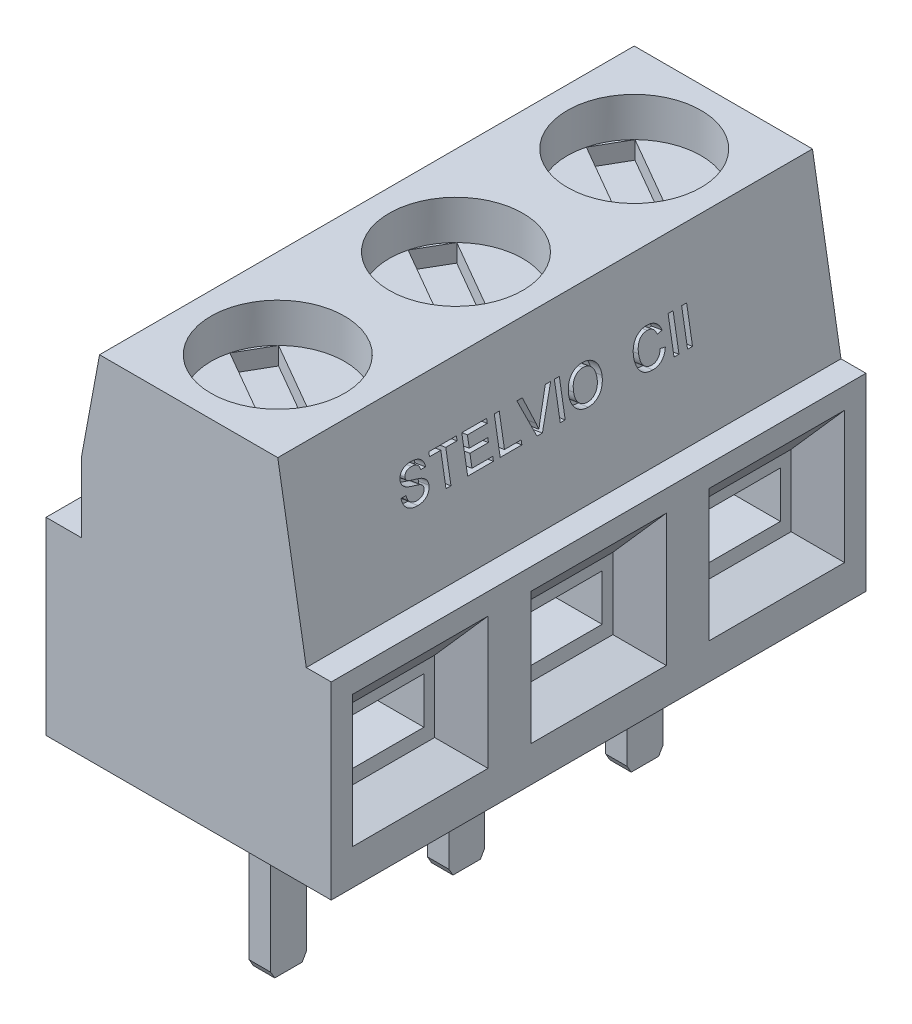
from build123d import *
from OCP.BRepFilletAPI import BRepFilletAPI_MakeChamfer

# Parameters (mm, degrees)
Z_KLAD_PROTA_EN_DEPTH    = 15
SKICA2_R                 = 1.875
ODEBR_N_PROTA_EN_1_DEPTH = 1.1
ODEBR_N_PROTA_EN_2_DEPTH = 0.5
SKICA4_W                 = 2.1
SKICA4_H                 = 3
SKICA4_W_2               = 1.2
SKICA4_H_2               = 1
ODEBR_N_PROTA_EN_3_DEPTH = 0.5
SKICA5_W                 = 2.8
SKICA5_H                 = 2
ODEBR_N_PROTA_EN_4_DEPTH = 1
LINE_RN_POLE1_COUNT      = 3
LINE_RN_POLE1_PITCH      = 5
ZKOSEN_1_SIZE            = 1.2
ZKOSEN_1_SIZE_2          = 1
ZKOSEN_2_SIZE            = 0.5
ZKOSEN_2_SIZE_2          = 1
SKICA6_W                 = 2.1
SKICA6_H                 = 1.3
ODEBR_N_PROTA_EN_5_DEPTH = 2
LINE_RN_POLE2_COUNT      = 3
LINE_RN_POLE2_PITCH      = 5
SKICA7_W                 = 0.6
SKICA7_H                 = 1
P_ID_N_PROTA_EN_1_DEPTH  = 4.8
LINE_RN_POLE3_COUNT      = 3
LINE_RN_POLE3_PITCH      = 5
ZKOSEN_3_SIZE            = 0.2
ZKOSEN_3_SIZE2           = 0.115470054
SKICA9_W                 = 0.139326146
SKICA9_H                 = 0.987949033
ODEBR_N_PROTA_EN_6_DEPTH = 0.3


# Some blends are built 0.0001 mm under size
with BuildPart() as part:
    # Skica1 → Základ-Protažení (new body)
    with BuildSketch(Plane.XY):
        Polygon((-2.5, 10), (2.5, 10), (3.3, 5.3), (4, 5.3), (4, 0), (-4, 0), (-4, 5.3), (-3, 5.3), (-3, 7.3), align=None)
    extrude(amount=Z_KLAD_PROTA_EN_DEPTH)

    # Skica2 → Odebrání-Protažení1 (cut)
    with BuildSketch(Plane(origin=(0, 10, 0), x_dir=(-1, 0, 0), z_dir=(0, 1, 0))):
        with Locations(Location((0, 2.5, 0), (0, 0, 90))):
            Circle(SKICA2_R)
        with Locations(Location((0, 7.5, 0), (0, 0, 90))):
            Circle(SKICA2_R)
        with Locations(Location((0, 12.5, 0), (0, 0, 90))):
            Circle(SKICA2_R)
    extrude(amount=-ODEBR_N_PROTA_EN_1_DEPTH, mode=Mode.SUBTRACT)

    # Skica3 → Odebrání-Protažení2 (cut)
    with BuildSketch(Plane(origin=(0, 8.9, 0), x_dir=(-1, 0, 0), z_dir=(0, 1, 0))):
        Polygon((1.814998003, 2.029460683), (-1.314998003, 3.83656472), (-1.814998003, 2.970539317), (1.314998003, 1.16343528), align=None)
        Polygon((1.814998003, 7.029460683), (-1.314998003, 8.83656472), (-1.814998003, 7.970539317), (1.314998003, 6.16343528), align=None)
        Polygon((1.814998003, 12.029460683), (-1.314998003, 13.83656472), (-1.814998003, 12.970539317), (1.314998003, 11.16343528), align=None)
    extrude(amount=-ODEBR_N_PROTA_EN_2_DEPTH, mode=Mode.SUBTRACT)

    # Skica4 → Odebrání-Protažení3 (cut)
    with BuildSketch(Plane.ZY.offset(4)):
        with Locations((12.5, 3.8)):
            Rectangle(SKICA4_W, SKICA4_H)
        with Locations((12.5, 0.5)):
            Rectangle(SKICA4_W_2, SKICA4_H_2)
        with Locations((7.5, 3.8)):
            Rectangle(SKICA4_W, SKICA4_H)
        with Locations((7.5, 0.5)):
            Rectangle(SKICA4_W_2, SKICA4_H_2)
        with Locations((2.5, 3.8)):
            Rectangle(SKICA4_W, SKICA4_H)
        with Locations((2.5, 0.5)):
            Rectangle(SKICA4_W_2, SKICA4_H_2)
    extrude(amount=-ODEBR_N_PROTA_EN_3_DEPTH, mode=Mode.SUBTRACT)

    # Skica5 → Odebrání-Protažení4 (cut)
    with BuildSketch(Plane(origin=(4, 0, 0), x_dir=(0, 0, -1), z_dir=(1, 0, 0))):
        with Locations((-12.5, 2.5)):
            Rectangle(SKICA5_W, SKICA5_H)
    odebr_n_prota_en_4 = extrude(amount=-ODEBR_N_PROTA_EN_4_DEPTH, mode=Mode.SUBTRACT)

    # Lineární Pole1: Odebrání-Protažení4 ×3
    with Locations(*[(0, 0, -i * LINE_RN_POLE1_PITCH) for i in range(1, LINE_RN_POLE1_COUNT)]):
        add(odebr_n_prota_en_4, mode=Mode.SUBTRACT)

    # Zkosení1
    # the kernel refuses this chamfer: 1.2, 1 mm, written as the material it adds along each edge
    # the kernel refuses this chamfer: 1.2, 1 mm, written as the material it takes off along each edge
    with BuildSketch(Plane(origin=(4, 3.5, 13.9), x_dir=(0.024836286378920516, 0.9996915318631564, 0), z_dir=(0, 0, -1)), Plane(origin=(4, 3.5, 8.9), x_dir=(0.024836286378920516, 0.9996915318631564, 0), z_dir=(0, 0, -1)), Plane(origin=(4, 3.5, 3.9), x_dir=(0.024836286378920516, 0.9996915318631564, 0), z_dir=(0, 0, -1))) as zkosen_1_2_piece_1:
        Polygon((ZKOSEN_1_SIZE * 0.999691531863, -ZKOSEN_1_SIZE * 0.0248362863789), (-ZKOSEN_1_SIZE_2 * 0.0248362863789, -ZKOSEN_1_SIZE_2 * 0.999691531863), (0, 0), align=None)
    extrude(amount=2.8, mode=Mode.SUBTRACT)
    with BuildSketch(Plane(origin=(4, 3.5, 16.993140689), x_dir=(0.024836286378920505, 0.9996915318631564, 0), z_dir=(0, 0, -1))) as zkosen_1_2_piece_2_section:
        Polygon((ZKOSEN_1_SIZE * 0.999691531863, -ZKOSEN_1_SIZE * 0.0248362863789), (-ZKOSEN_1_SIZE_2 * 0.0248362863789, -ZKOSEN_1_SIZE_2 * 0.999691531863), (0, 0), align=None)
    zkosen_1_2_piece_2 = extrude(amount=8.986281378, mode=Mode.PRIVATE)
    zkosen_1_2_piece_2 = split(zkosen_1_2_piece_2, bisect_by=Plane(origin=(3.666666667, 3.9, 8.9), z_dir=(0, 0, -1)), keep=Keep.TOP, mode=Mode.PRIVATE)
    add(zkosen_1_2_piece_2, mode=Mode.SUBTRACT)
    with BuildSketch(Plane(origin=(4, 3.5, 11.993140689), x_dir=(0.024836286378920505, 0.9996915318631564, 0), z_dir=(0, 0, -1))) as zkosen_1_2_piece_3_section:
        Polygon((ZKOSEN_1_SIZE * 0.999691531863, -ZKOSEN_1_SIZE * 0.0248362863789), (-ZKOSEN_1_SIZE_2 * 0.0248362863789, -ZKOSEN_1_SIZE_2 * 0.999691531863), (0, 0), align=None)
    zkosen_1_2_piece_3 = extrude(amount=8.986281378, mode=Mode.PRIVATE)
    zkosen_1_2_piece_3 = split(zkosen_1_2_piece_3, bisect_by=Plane(origin=(3.666666667, 3.9, 11.1), z_dir=(0, 0, 1)), keep=Keep.TOP, mode=Mode.PRIVATE)
    add(zkosen_1_2_piece_3, mode=Mode.SUBTRACT)
    with BuildSketch(Plane(origin=(4, 3.5, 11.993140689), x_dir=(0.024836286378920505, 0.9996915318631564, 0), z_dir=(0, 0, -1))) as zkosen_1_2_piece_4_section:
        Polygon((ZKOSEN_1_SIZE * 0.999691531863, -ZKOSEN_1_SIZE * 0.0248362863789), (-ZKOSEN_1_SIZE_2 * 0.0248362863789, -ZKOSEN_1_SIZE_2 * 0.999691531863), (0, 0), align=None)
    zkosen_1_2_piece_4 = extrude(amount=8.986281378, mode=Mode.PRIVATE)
    zkosen_1_2_piece_4 = split(zkosen_1_2_piece_4, bisect_by=Plane(origin=(3.666666667, 3.9, 3.9), z_dir=(0, 0, -1)), keep=Keep.TOP, mode=Mode.PRIVATE)
    add(zkosen_1_2_piece_4, mode=Mode.SUBTRACT)
    with BuildSketch(Plane(origin=(4, 3.5, 6.993140689), x_dir=(0.024836286378920505, 0.9996915318631564, 0), z_dir=(0, 0, -1))) as zkosen_1_2_piece_5_section:
        Polygon((ZKOSEN_1_SIZE * 0.999691531863, -ZKOSEN_1_SIZE * 0.0248362863789), (-ZKOSEN_1_SIZE_2 * 0.0248362863789, -ZKOSEN_1_SIZE_2 * 0.999691531863), (0, 0), align=None)
    zkosen_1_2_piece_5 = extrude(amount=8.986281378, mode=Mode.PRIVATE)
    zkosen_1_2_piece_5 = split(zkosen_1_2_piece_5, bisect_by=Plane(origin=(3.666666667, 3.9, 6.1), z_dir=(0, 0, 1)), keep=Keep.TOP, mode=Mode.PRIVATE)
    add(zkosen_1_2_piece_5, mode=Mode.SUBTRACT)

    # Zkosení2
    zkosen_2_edges_1 = [part.edges().sort_by_distance(p)[0] for p in [
        (4, 3.1, 13.9),
    ]]
    zkosen_2_side_1 = [part.faces().sort_by_distance(p)[0] for p in [
        (4, 3.1, 13.91),
    ]]
    zkosen_2_edges_2 = [part.edges().sort_by_distance(p)[0] for p in [
        (4, 1.5, 12.5),
    ]]
    zkosen_2_side_2 = [part.faces().sort_by_distance(p)[0] for p in [
        (4, 1.49, 12.5),
    ]]
    zkosen_2_edges_3 = [part.edges().sort_by_distance(p)[0] for p in [
        (4, 3.1, 11.1),
    ]]
    zkosen_2_side_3 = [part.faces().sort_by_distance(p)[0] for p in [
        (4, 3.1, 11.09),
    ]]
    zkosen_2_edges_4 = [part.edges().sort_by_distance(p)[0] for p in [
        (4, 3.1, 8.9),
    ]]
    zkosen_2_side_4 = [part.faces().sort_by_distance(p)[0] for p in [
        (4, 3.1, 8.91),
    ]]
    zkosen_2_edges_5 = [part.edges().sort_by_distance(p)[0] for p in [
        (4, 1.5, 7.5),
    ]]
    zkosen_2_side_5 = [part.faces().sort_by_distance(p)[0] for p in [
        (4, 1.49, 7.5),
    ]]
    zkosen_2_edges_6 = [part.edges().sort_by_distance(p)[0] for p in [
        (4, 3.1, 6.1),
    ]]
    zkosen_2_side_6 = [part.faces().sort_by_distance(p)[0] for p in [
        (4, 3.1, 6.09),
    ]]
    zkosen_2_edges_7 = [part.edges().sort_by_distance(p)[0] for p in [
        (4, 3.1, 3.9),
    ]]
    zkosen_2_side_7 = [part.faces().sort_by_distance(p)[0] for p in [
        (4, 3.1, 3.91),
    ]]
    zkosen_2_edges_8 = [part.edges().sort_by_distance(p)[0] for p in [
        (4, 3.1, 1.1),
    ]]
    zkosen_2_side_8 = [part.faces().sort_by_distance(p)[0] for p in [
        (4, 3.1, 1.09),
    ]]
    zkosen_2_edges_9 = [part.edges().sort_by_distance(p)[0] for p in [
        (4, 1.5, 2.5),
    ]]
    zkosen_2_side_9 = [part.faces().sort_by_distance(p)[0] for p in [
        (4, 1.49, 2.5),
    ]]
    zkosen_2 = BRepFilletAPI_MakeChamfer(part.part.solid().wrapped)
    for e in zkosen_2_edges_1:
        zkosen_2.Add(ZKOSEN_2_SIZE - 0.0001, ZKOSEN_2_SIZE_2 - 0.0001, e.wrapped, zkosen_2_side_1[0].wrapped)
    for e in zkosen_2_edges_2:
        zkosen_2.Add(ZKOSEN_2_SIZE - 0.0001, ZKOSEN_2_SIZE_2 - 0.0001, e.wrapped, zkosen_2_side_2[0].wrapped)
    for e in zkosen_2_edges_3:
        zkosen_2.Add(ZKOSEN_2_SIZE - 0.0001, ZKOSEN_2_SIZE_2 - 0.0001, e.wrapped, zkosen_2_side_3[0].wrapped)
    for e in zkosen_2_edges_4:
        zkosen_2.Add(ZKOSEN_2_SIZE - 0.0001, ZKOSEN_2_SIZE_2 - 0.0001, e.wrapped, zkosen_2_side_4[0].wrapped)
    for e in zkosen_2_edges_5:
        zkosen_2.Add(ZKOSEN_2_SIZE - 0.0001, ZKOSEN_2_SIZE_2 - 0.0001, e.wrapped, zkosen_2_side_5[0].wrapped)
    for e in zkosen_2_edges_6:
        zkosen_2.Add(ZKOSEN_2_SIZE - 0.0001, ZKOSEN_2_SIZE_2 - 0.0001, e.wrapped, zkosen_2_side_6[0].wrapped)
    for e in zkosen_2_edges_7:
        zkosen_2.Add(ZKOSEN_2_SIZE - 0.0001, ZKOSEN_2_SIZE_2 - 0.0001, e.wrapped, zkosen_2_side_7[0].wrapped)
    for e in zkosen_2_edges_8:
        zkosen_2.Add(ZKOSEN_2_SIZE - 0.0001, ZKOSEN_2_SIZE_2 - 0.0001, e.wrapped, zkosen_2_side_8[0].wrapped)
    for e in zkosen_2_edges_9:
        zkosen_2.Add(ZKOSEN_2_SIZE - 0.0001, ZKOSEN_2_SIZE_2 - 0.0001, e.wrapped, zkosen_2_side_9[0].wrapped)
    add(Compound.cast(zkosen_2.Shape()), mode=Mode.REPLACE)  # a hair under: the kernel refuses the full size

    # Skica6 → Odebrání-Protažení5 (cut)
    with BuildSketch(Plane(origin=(3, 0, 0), x_dir=(0, 0, -1), z_dir=(1, 0, 0))):
        with Locations((-12.45, 2.55)):
            Rectangle(SKICA6_W, SKICA6_H)
    odebr_n_prota_en_5 = extrude(amount=-ODEBR_N_PROTA_EN_5_DEPTH, mode=Mode.SUBTRACT)

    # Lineární Pole2: Odebrání-Protažení5 ×3
    with Locations(*[(0, 0, -i * LINE_RN_POLE2_PITCH) for i in range(1, LINE_RN_POLE2_COUNT)]):
        add(odebr_n_prota_en_5, mode=Mode.SUBTRACT)

    # Skica7 → Přidání-Protažení1 (add)
    with BuildSketch(Plane.XZ):
        with Locations((0, 2.5)):
            Rectangle(SKICA7_W, SKICA7_H)
    p_id_n_prota_en_1 = extrude(amount=P_ID_N_PROTA_EN_1_DEPTH)

    # Lineární Pole3: Přidání-Protažení1 ×3
    with Locations(*[(0, 0, i * LINE_RN_POLE3_PITCH) for i in range(1, LINE_RN_POLE3_COUNT)]):
        add(p_id_n_prota_en_1)

    # Zkosení3: one chamfer whose edges measure the first distance from different faces: ONE call of the kernel's chamfer builder (chamfer() names one face for all edges)
    zkosen_3_edges_1 = [part.edges().sort_by_distance(p)[0] for p in [
        (0, -4.8, 2),
    ]]
    zkosen_3_side_1 = [part.faces().sort_by_distance(p)[0] for p in [
        (0, -2.4, 2),
    ]]
    zkosen_3_edges_2 = [part.edges().sort_by_distance(p)[0] for p in [
        (0, -4.8, 3),
    ]]
    zkosen_3_side_2 = [part.faces().sort_by_distance(p)[0] for p in [
        (0, -2.4, 3),
    ]]
    zkosen_3_edges_3 = [part.edges().sort_by_distance(p)[0] for p in [
        (0, -4.8, 7),
    ]]
    zkosen_3_side_3 = [part.faces().sort_by_distance(p)[0] for p in [
        (0, -2.4, 7),
    ]]
    zkosen_3_edges_4 = [part.edges().sort_by_distance(p)[0] for p in [
        (0, -4.8, 8),
    ]]
    zkosen_3_side_4 = [part.faces().sort_by_distance(p)[0] for p in [
        (0, -2.4, 8),
    ]]
    zkosen_3_edges_5 = [part.edges().sort_by_distance(p)[0] for p in [
        (0, -4.8, 12),
    ]]
    zkosen_3_side_5 = [part.faces().sort_by_distance(p)[0] for p in [
        (0, -2.4, 12),
    ]]
    zkosen_3_edges_6 = [part.edges().sort_by_distance(p)[0] for p in [
        (0, -4.8, 13),
    ]]
    zkosen_3_side_6 = [part.faces().sort_by_distance(p)[0] for p in [
        (0, -2.4, 13),
    ]]
    zkosen_3 = BRepFilletAPI_MakeChamfer(part.part.solid().wrapped)
    for e in zkosen_3_edges_1:
        zkosen_3.Add(ZKOSEN_3_SIZE, ZKOSEN_3_SIZE2, e.wrapped, zkosen_3_side_1[0].wrapped)  # the first distance lies on this face
    for e in zkosen_3_edges_2:
        zkosen_3.Add(ZKOSEN_3_SIZE, ZKOSEN_3_SIZE2, e.wrapped, zkosen_3_side_2[0].wrapped)  # the first distance lies on this face
    for e in zkosen_3_edges_3:
        zkosen_3.Add(ZKOSEN_3_SIZE, ZKOSEN_3_SIZE2, e.wrapped, zkosen_3_side_3[0].wrapped)  # the first distance lies on this face
    for e in zkosen_3_edges_4:
        zkosen_3.Add(ZKOSEN_3_SIZE, ZKOSEN_3_SIZE2, e.wrapped, zkosen_3_side_4[0].wrapped)  # the first distance lies on this face
    for e in zkosen_3_edges_5:
        zkosen_3.Add(ZKOSEN_3_SIZE, ZKOSEN_3_SIZE2, e.wrapped, zkosen_3_side_5[0].wrapped)  # the first distance lies on this face
    for e in zkosen_3_edges_6:
        zkosen_3.Add(ZKOSEN_3_SIZE, ZKOSEN_3_SIZE2, e.wrapped, zkosen_3_side_6[0].wrapped)  # the first distance lies on this face
    add(Compound.cast(zkosen_3.Shape()), mode=Mode.REPLACE)

    # Skica9 → Odebrání-Protažení6 (cut)
    # profile 1 of 10: a face of its own
    with BuildSketch(Plane(origin=(4.083809943, 0.695116586, 0), x_dir=(0, 0, -1), z_dir=(0.9858211697841271, 0.16779934804836208, 0))):
        with BuildLine():
            Line((-11.936669934, 7.080695685), (-11.797343788, 7.080695685))
            add(Edge.make_bspline(
                [(-11.797343788, 7.080695685), (-11.795811281, 7.068186113), (-11.792867253, 7.044154552), (-11.784635457, 7.010093431), (-11.774040604, 6.979468988), (-11.760839709, 6.951874782), (-11.743474434, 6.927641666), (-11.722552266, 6.905783766), (-11.697143431, 6.886856147), (-11.668462648, 6.870011807), (-11.636520261, 6.856786336), (-11.602418913, 6.846982076), (-11.56632124, 6.841172975), (-11.541603774, 6.840423915), (-11.528982632, 6.840041434)],
                knots=[0, 0, 0, 0, 1.125557648, 2.162256852, 3.1243583, 4.018160113, 4.88511607, 5.777380551, 6.711250965, 7.707237736, 8.743031335, 9.791730543, 10.872421559, 12, 12, 12, 12], degree=3))
            add(Edge.make_bspline(
                [(-11.528982632, 6.840041434), (-11.517814009, 6.840248153), (-11.496037356, 6.840651216), (-11.464534994, 6.845492997), (-11.43489118, 6.852360933), (-11.407657616, 6.862749762), (-11.382934763, 6.875365057), (-11.361465736, 6.890623553), (-11.343136622, 6.907830945), (-11.328783598, 6.927440466), (-11.317508148, 6.947987965), (-11.30923644, 6.969108675), (-11.304309154, 6.990685365), (-11.303681289, 7.005203275), (-11.303369272, 7.012417958)],
                knots=[0, 0, 0, 0, 1.267006637, 2.470417599, 3.611360613, 4.716023143, 5.771382139, 6.754486395, 7.697536124, 8.612899418, 9.501261124, 10.352596716, 11.181322154, 12, 12, 12, 12], degree=3))
            add(Edge.make_bspline(
                [(-11.303369272, 7.012417958), (-11.303702824, 7.019559559), (-11.304354752, 7.03351781), (-11.308603186, 7.053839279), (-11.316677936, 7.072439325), (-11.327155852, 7.090077117), (-11.341732421, 7.106203056), (-11.360148272, 7.121061671), (-11.382809151, 7.134532635), (-11.399722088, 7.14191012), (-11.408655507, 7.14580691)],
                knots=[0, 0, 0, 0, 0.942140154, 1.841411588, 2.718743672, 3.605002079, 4.535543111, 5.568170452, 6.715506882, 8, 8, 8, 8], degree=3))
            add(Edge.make_bspline(
                [(-11.408655507, 7.14580691), (-11.412136099, 7.14723523), (-11.419999388, 7.150462064), (-11.433476698, 7.154733838), (-11.449469232, 7.160257677), (-11.468361199, 7.165946332), (-11.490051462, 7.171964133), (-11.514503909, 7.178775372), (-11.541704875, 7.186018751), (-11.570882896, 7.19372854), (-11.600343805, 7.201568213), (-11.628490262, 7.209415227), (-11.65438634, 7.217380952), (-11.678244164, 7.225050845), (-11.699940735, 7.232752382), (-11.719537633, 7.240274711), (-11.737059292, 7.247465213), (-11.747760854, 7.25275228), (-11.752814835, 7.25524918)],
                knots=[0, 0, 0, 0, 0.499201778, 1.127787504, 1.87543728, 2.745208432, 3.745951656, 4.863402235, 6.114490242, 7.482339553, 8.869366102, 10.161191451, 11.360587006, 12.46547846, 13.487450326, 14.41601931, 15.251940103, 16, 16, 16, 16], degree=3))
            add(Edge.make_bspline(
                [(-11.752814835, 7.25524918), (-11.764442637, 7.261530854), (-11.786887321, 7.273656119), (-11.81709538, 7.295336126), (-11.842548737, 7.319394107), (-11.863140007, 7.345795177), (-11.879276581, 7.374092829), (-11.890163856, 7.404335171), (-11.897620741, 7.435973247), (-11.898317606, 7.457729384), (-11.898671894, 7.468790247)],
                knots=[0, 0, 0, 0, 1.158441928, 2.236094408, 3.251151369, 4.220012324, 5.163146324, 6.095083285, 7.031536583, 8, 8, 8, 8], degree=3))
            add(Edge.make_bspline(
                [(-11.898671894, 7.468790247), (-11.898201684, 7.481038285), (-11.897266439, 7.505399543), (-11.888970305, 7.541148171), (-11.875737813, 7.575547859), (-11.860675218, 7.602858276), (-11.845985859, 7.623510291), (-11.83380827, 7.638383495), (-11.820148721, 7.652131773), (-11.80542788, 7.66494704), (-11.789382596, 7.676637823), (-11.772410956, 7.687684598), (-11.75389868, 7.697179566), (-11.727886179, 7.709264517), (-11.69308772, 7.721332471), (-11.649280813, 7.731848162), (-11.603175481, 7.738040634), (-11.571749004, 7.738893056), (-11.555700004, 7.739328374)],
                knots=[0, 0, 0, 0, 1.199927478, 2.386647047, 3.578628709, 4.806592355, 5.433127754, 6.062729195, 6.689531802, 7.331674828, 7.974827539, 8.635320743, 9.315455226, 10.01318112, 11.447700238, 12.918145351, 14.426146008, 16, 16, 16, 16], degree=3))
            add(Edge.make_bspline(
                [(-11.555700004, 7.739328374), (-11.538133307, 7.73892586), (-11.503927564, 7.738142088), (-11.454225652, 7.731621244), (-11.407867374, 7.72042324), (-11.371511622, 7.707888198), (-11.34463424, 7.695198169), (-11.325539799, 7.685296268), (-11.307816382, 7.673847867), (-11.291304442, 7.661458906), (-11.275850607, 7.648135042), (-11.261852073, 7.633559347), (-11.248700987, 7.618229115), (-11.233246627, 7.596219705), (-11.216583551, 7.567090375), (-11.202176054, 7.529352172), (-11.192277935, 7.489522597), (-11.190352523, 7.461987392), (-11.189375152, 7.448010069)],
                knots=[0, 0, 0, 0, 1.607600973, 3.130308851, 4.577334065, 5.967726088, 6.640410691, 7.296826776, 7.935019992, 8.569057421, 9.185393759, 9.8003086, 10.417295362, 11.032210203, 12.259799365, 13.477607022, 14.719591916, 16, 16, 16, 16], degree=3))
            Line((-11.189375152, 7.448010069), (-11.328701298, 7.448010069))
            add(Edge.make_bspline(
                [(-11.328701298, 7.448010069), (-11.329586556, 7.455084401), (-11.331318743, 7.468926771), (-11.335616069, 7.488965684), (-11.341640056, 7.507576924), (-11.348695991, 7.524934055), (-11.357249261, 7.540856543), (-11.367219899, 7.555497278), (-11.378729326, 7.568683768), (-11.391481392, 7.58076445), (-11.405864141, 7.591283351), (-11.421803669, 7.600414081), (-11.439326883, 7.608127457), (-11.458418345, 7.614444963), (-11.479081835, 7.619343311), (-11.501364351, 7.622946629), (-11.525257282, 7.624792049), (-11.541711972, 7.625150336), (-11.550158623, 7.625334255)],
                knots=[0, 0, 0, 0, 1.074487479, 2.102453544, 3.083708351, 4.020042547, 4.923259678, 5.803182661, 6.684453325, 7.556870173, 8.445961597, 9.363679789, 10.320905216, 11.327237703, 12.390948353, 13.519046902, 14.726457512, 16, 16, 16, 16], degree=3))
            add(Edge.make_bspline(
                [(-11.550158623, 7.625334255), (-11.558938524, 7.625268076), (-11.575934251, 7.62513997), (-11.600503503, 7.622804762), (-11.623276023, 7.619600774), (-11.644212698, 7.614874619), (-11.663244941, 7.608688067), (-11.68065522, 7.601544018), (-11.695956287, 7.592490643), (-11.709504839, 7.58240636), (-11.72119218, 7.571248658), (-11.731264938, 7.559491138), (-11.740173513, 7.547479244), (-11.747095673, 7.534556398), (-11.752731352, 7.521212008), (-11.756366984, 7.507195243), (-11.758941096, 7.492765377), (-11.759209, 7.48291959), (-11.759345748, 7.477893944)],
                knots=[0, 0, 0, 0, 1.464176581, 2.834285765, 4.113735764, 5.29917439, 6.409476712, 7.449999357, 8.431575861, 9.367089851, 10.262376129, 11.120706676, 11.948504824, 12.751342953, 13.560717798, 14.359016663, 15.162382702, 16, 16, 16, 16], degree=3))
            add(Edge.make_bspline(
                [(-11.759345748, 7.477893944), (-11.758985697, 7.469394065), (-11.75828687, 7.452896583), (-11.751150826, 7.429458635), (-11.74017554, 7.408093426), (-11.729363135, 7.396468725), (-11.723920493, 7.390617197)],
                knots=[0, 0, 0, 0, 1.050964922, 2.039826012, 3.013306874, 4, 4, 4, 4], degree=3))
            add(Edge.make_bspline(
                [(-11.723920493, 7.390617197), (-11.720489509, 7.387692883), (-11.7129021, 7.381225944), (-11.698784557, 7.372667708), (-11.681280897, 7.3640207), (-11.660274164, 7.355424906), (-11.6358005, 7.346775972), (-11.607899383, 7.337870832), (-11.576464539, 7.329026362), (-11.542453946, 7.320503252), (-11.508095316, 7.311945879), (-11.475443067, 7.30342112), (-11.445462774, 7.295341994), (-11.418202006, 7.287462131), (-11.393632545, 7.279803811), (-11.371839779, 7.272206582), (-11.352647397, 7.265219059), (-11.340889796, 7.260302766), (-11.335430118, 7.258019871)],
                knots=[0, 0, 0, 0, 0.523891492, 1.158553688, 1.913783773, 2.794766643, 3.797521443, 4.933638669, 6.202080764, 7.596537849, 9.013317056, 10.322179469, 11.523240428, 12.626146501, 13.623953177, 14.517289671, 15.311498917, 16, 16, 16, 16], degree=3))
            add(Edge.make_bspline(
                [(-11.335430118, 7.258019871), (-11.328326799, 7.254744785), (-11.314384176, 7.24831634), (-11.294632582, 7.237340737), (-11.276202203, 7.225943165), (-11.259241942, 7.213816762), (-11.243806641, 7.20093602), (-11.229723716, 7.187448524), (-11.216908109, 7.173430077), (-11.205876931, 7.158432006), (-11.195972064, 7.143060601), (-11.187304646, 7.127101028), (-11.180325807, 7.110459429), (-11.17420493, 7.093336406), (-11.169802264, 7.075541499), (-11.166349686, 7.057254449), (-11.164335855, 7.038389303), (-11.164141546, 7.025616403), (-11.164043126, 7.019146777)],
                knots=[0, 0, 0, 0, 1.198900896, 2.353241543, 3.461831299, 4.520043694, 5.547003373, 6.541368882, 7.508191797, 8.454912692, 9.392021408, 10.310662301, 11.235020644, 12.156274873, 13.095836685, 14.042125239, 15.00831306, 16, 16, 16, 16], degree=3))
            add(Edge.make_bspline(
                [(-11.164043126, 7.019146777), (-11.164558718, 7.006235162), (-11.165582339, 6.980601314), (-11.174396087, 6.942815837), (-11.18824202, 6.906201921), (-11.204479805, 6.877146762), (-11.21982942, 6.854952842), (-11.232723821, 6.839000868), (-11.24702297, 6.824250836), (-11.262374837, 6.810240657), (-11.278898614, 6.797256184), (-11.296733608, 6.785292997), (-11.315691578, 6.774226558), (-11.342763083, 6.760741454), (-11.378718538, 6.746634755), (-11.42451857, 6.734887174), (-11.472786256, 6.727266227), (-11.505929829, 6.726459234), (-11.522847532, 6.726047314)],
                knots=[0, 0, 0, 0, 1.197055466, 2.376552968, 3.581957237, 4.820753935, 5.454298064, 6.085440993, 6.72202542, 7.359198513, 8.013298489, 8.67051481, 9.351020706, 10.049282741, 11.476266879, 12.925760103, 14.430794493, 16, 16, 16, 16], degree=3))
            add(Edge.make_bspline(
                [(-11.522847532, 6.726047314), (-11.533604159, 6.726136083), (-11.554674854, 6.726309968), (-11.585635887, 6.72841577), (-11.61530641, 6.731461916), (-11.643657307, 6.735999185), (-11.670599672, 6.741951835), (-11.696230216, 6.749099817), (-11.720609689, 6.757332192), (-11.74365291, 6.767013323), (-11.765299726, 6.778261739), (-11.785939369, 6.790395934), (-11.80523447, 6.804150613), (-11.823225647, 6.819309641), (-11.84036876, 6.835435089), (-11.855953276, 6.853185506), (-11.870509029, 6.872041805), (-11.883703426, 6.892176568), (-11.89549061, 6.913326365), (-11.906090647, 6.935136007), (-11.915021327, 6.957763706), (-11.922218605, 6.981095103), (-11.928315064, 7.004974064), (-11.932542817, 7.029599817), (-11.935651204, 7.054895045), (-11.936328351, 7.072044673), (-11.936669934, 7.080695685)],
                knots=[0, 0, 0, 0, 1.259822038, 2.467811403, 3.633536148, 4.752793854, 5.829021491, 6.863980041, 7.868367876, 8.841470325, 9.788447787, 10.724101269, 11.643985084, 12.560193707, 13.478453146, 14.398077254, 15.323914234, 16.266973849, 17.21495974, 18.158525798, 19.105629373, 20.061269543, 21.017128399, 21.990322895, 22.986232211, 24, 24, 24, 24], degree=3))
        make_face()
    # profile 2 of 10: a face of its own
    with BuildSketch(Plane(origin=(4.083809943, 0.695116586, 0), x_dir=(0, 0, -1), z_dir=(0.9858211697841271, 0.16779934804836208, 0))):
        Polygon((-10.733398676, 6.738713328), (-10.733398676, 7.612668242), (-11.050049007, 7.612668242), (-11.050049007, 7.726662361), (-10.277422199, 7.726662361), (-10.277422199, 7.612668242), (-10.59407253, 7.612668242), (-10.59407253, 6.738713328), align=None)
    # profile 3 of 10: a face of its own
    with BuildSketch(Plane(origin=(4.083809943, 0.695116586, 0), x_dir=(0, 0, -1), z_dir=(0.9858211697841271, 0.16779934804836208, 0))):
        Polygon((-10.12543004, 6.738713328), (-10.12543004, 7.726662361), (-9.428799311, 7.726662361), (-9.428799311, 7.612668242), (-9.986103894, 7.612668242), (-9.986103894, 7.308683924), (-9.466797351, 7.308683924), (-9.466797351, 7.194689805), (-9.986103894, 7.194689805), (-9.986103894, 6.852707447), (-9.403467285, 6.852707447), (-9.403467285, 6.738713328), align=None)
    # profile 4 of 10: a face of its own
    with BuildSketch(Plane(origin=(4.083809943, 0.695116586, 0), x_dir=(0, 0, -1), z_dir=(0.9858211697841271, 0.16779934804836208, 0))):
        Polygon((-9.213477086, 6.738713328), (-9.213477086, 7.726662361), (-9.074150941, 7.726662361), (-9.074150941, 6.852707447), (-8.60550845, 6.852707447), (-8.60550845, 6.738713328), align=None)
    # profile 5 of 10: a face of its own
    with BuildSketch(Plane(origin=(4.083809943, 0.695116586, 0), x_dir=(0, 0, -1), z_dir=(0.9858211697841271, 0.16779934804836208, 0))):
        with BuildLine():
            Line((-8.180801194, 6.738713328), (-8.579186892, 7.726662361))
            Line((-8.579186892, 7.726662361), (-8.428184265, 7.726662361))
            Line((-8.428184265, 7.726662361), (-8.159427296, 7.018553058))
            add(Edge.make_bspline(
                [(-8.159427296, 7.018553058), (-8.154167989, 7.004585298), (-8.143879699, 6.977261479), (-8.12953267, 6.936714805), (-8.11670729, 6.897504104), (-8.108975031, 6.871656587), (-8.105200927, 6.859040454)],
                knots=[0, 0, 0, 0, 1.062747156, 2.078952616, 3.062339733, 4, 4, 4, 4], degree=3))
            add(Edge.make_bspline(
                [(-8.105200927, 6.859040454), (-8.097166416, 6.885719165), (-8.080982199, 6.939459095), (-8.061419333, 6.992063595), (-8.051568277, 7.018553058)],
                knots=[0, 0, 0, 0, 0.992882236, 2, 2, 2, 2], degree=3))
            Line((-8.051568277, 7.018553058), (-7.78221759, 7.726662361))
            Line((-7.78221759, 7.726662361), (-7.631214963, 7.726662361))
            Line((-7.631214963, 7.726662361), (-8.029798567, 6.738713328))
            Line((-8.029798567, 6.738713328), (-8.180801194, 6.738713328))
        make_face()
    # profile 6 of 10: a face of its own
    with BuildSketch(Plane(origin=(4.083809943, 0.695116586, 0), x_dir=(0, 0, -1), z_dir=(0.9858211697841271, 0.16779934804836208, 0))):
        with Locations((-7.459234252, 7.232687845)):
            Rectangle(SKICA9_W, SKICA9_H)
    # profile 7 of 10: a face of its own
    with BuildSketch(Plane(origin=(4.083809943, 0.695116586, 0), x_dir=(0, 0, -1), z_dir=(0.9858211697841271, 0.16779934804836208, 0))):
        with BuildLine():
            add(Edge.make_bspline(
                [(-7.212246994, 7.219626018), (-7.21190362, 7.239433545), (-7.211234575, 7.278027506), (-7.204983327, 7.334225286), (-7.194832905, 7.387100046), (-7.180321978, 7.436647667), (-7.161929337, 7.482945789), (-7.139569568, 7.526099249), (-7.112570103, 7.56561958), (-7.082026829, 7.601882989), (-7.047911395, 7.633942501), (-7.011588154, 7.662415941), (-6.972603543, 7.686166156), (-6.93131775, 7.705776004), (-6.887555369, 7.720831877), (-6.841439272, 7.731372359), (-6.79301878, 7.738171993), (-6.75992224, 7.738937315), (-6.743010784, 7.739328374)],
                knots=[0, 0, 0, 0, 1.203621547, 2.345195544, 3.432004029, 4.472479546, 5.478447225, 6.455936844, 7.420185704, 8.381829745, 9.332027588, 10.260832629, 11.182364398, 12.100723901, 13.034044877, 13.989196293, 14.972532542, 16, 16, 16, 16], degree=3))
            add(Edge.make_bspline(
                [(-6.743010784, 7.739328374), (-6.731856517, 7.7391336), (-6.70970616, 7.738746813), (-6.676958834, 7.735803881), (-6.645053, 7.730551257), (-6.614020075, 7.723512152), (-6.58377559, 7.714277152), (-6.554301481, 7.703375516), (-6.525855762, 7.689866854), (-6.498249192, 7.674742563), (-6.471807645, 7.657825389), (-6.446957945, 7.639137022), (-6.423759615, 7.6188188), (-6.401901039, 7.597204699), (-6.382111607, 7.573565275), (-6.363573767, 7.548620624), (-6.346820214, 7.521928438), (-6.331791504, 7.493707412), (-6.318354309, 7.464393418), (-6.306869632, 7.433864958), (-6.297007949, 7.402488244), (-6.288752889, 7.37007756), (-6.28282966, 7.336643985), (-6.278112929, 7.302331581), (-6.275630383, 7.267028204), (-6.275186683, 7.243180144), (-6.274962013, 7.231104593)],
                knots=[0, 0, 0, 0, 1.034375294, 2.054082248, 3.045783978, 4.031219655, 5.002789406, 5.976610191, 6.94273282, 7.920236376, 8.894345378, 9.851183672, 10.800797181, 11.752517031, 12.698794154, 13.65688337, 14.632873302, 15.61821402, 16.620222298, 17.621258913, 18.640965868, 19.669244166, 20.720417492, 21.788124603, 22.880008887, 24, 24, 24, 24], degree=3))
            add(Edge.make_bspline(
                [(-6.274962013, 7.231104593), (-6.275167859, 7.218829915), (-6.275574544, 7.194579173), (-6.278326336, 7.158753406), (-6.283164943, 7.123956124), (-6.289582532, 7.090083565), (-6.298181905, 7.057206247), (-6.308400938, 7.025229907), (-6.320761436, 6.994345003), (-6.334721246, 6.964477096), (-6.350516765, 6.936036973), (-6.367940295, 6.909223502), (-6.387004178, 6.8842875), (-6.407418837, 6.860923068), (-6.429661008, 6.839548004), (-6.453456809, 6.819962436), (-6.478714745, 6.801981651), (-6.50551967, 6.786092623), (-6.533390533, 6.772165322), (-6.561775814, 6.759809298), (-6.590696598, 6.749271588), (-6.620251727, 6.740731822), (-6.650360578, 6.73427856), (-6.680938421, 6.729446289), (-6.712085494, 6.726663851), (-6.733044179, 6.726253883), (-6.743604503, 6.726047314)],
                knots=[0, 0, 0, 0, 1.141429366, 2.255090526, 3.338676798, 4.407031443, 5.458968682, 6.496860253, 7.526652771, 8.550250826, 9.560787671, 10.54935636, 11.521089193, 12.477323897, 13.431786008, 14.386110112, 15.340986122, 16.312041, 17.28047646, 18.236612773, 19.189437236, 20.140779471, 21.09494583, 22.051062463, 23.018000708, 24, 24, 24, 24], degree=3))
            add(Edge.make_bspline(
                [(-6.743604503, 6.726047314), (-6.754959198, 6.726215309), (-6.777450005, 6.726548063), (-6.810692023, 6.729869518), (-6.843107032, 6.734936513), (-6.874600795, 6.742251723), (-6.905130278, 6.751794931), (-6.934731604, 6.763345729), (-6.963508884, 6.776749742), (-6.99110504, 6.792390773), (-7.017426145, 6.809781918), (-7.042217086, 6.828836726), (-7.065464155, 6.849379591), (-7.086794331, 6.871750062), (-7.106898431, 6.8951372), (-7.124972603, 6.920410291), (-7.141607121, 6.946996167), (-7.156309744, 6.975151106), (-7.169591363, 7.004038448), (-7.180781414, 7.033667434), (-7.190615299, 7.063601412), (-7.198446994, 7.094024882), (-7.204687902, 7.124867665), (-7.20888446, 7.156078438), (-7.211915246, 7.187703685), (-7.212135855, 7.208931692), (-7.212246994, 7.219626018)],
                knots=[0, 0, 0, 0, 1.072727997, 2.12480551, 3.153819198, 4.171534612, 5.177148798, 6.173931848, 7.17235114, 8.174500385, 9.168706755, 10.151274001, 11.127173509, 12.097141049, 13.070188938, 14.039134204, 15.03036519, 16.031505612, 17.038625933, 18.033164522, 19.022845559, 20.014762458, 21.000193215, 21.994692725, 22.989758729, 24, 24, 24, 24], degree=3))
        make_face()
        with BuildLine():
            add(Edge.make_bspline(
                [(-7.072920848, 7.218042766), (-7.072707337, 7.20377956), (-7.072291006, 7.175967314), (-7.067527956, 7.135418539), (-7.060300789, 7.097158705), (-7.050338901, 7.061080407), (-7.036947684, 7.027540454), (-7.020936751, 6.99621656), (-7.001767009, 6.967316949), (-6.9798614, 6.940922463), (-6.955767741, 6.917211635), (-6.930021222, 6.896501488), (-6.902616054, 6.879158205), (-6.873856073, 6.864837622), (-6.843534709, 6.853659102), (-6.811742775, 6.845809826), (-6.778456911, 6.840900742), (-6.755760057, 6.840331438), (-6.744198223, 6.840041434)],
                knots=[0, 0, 0, 0, 1.215430442, 2.370003584, 3.475209778, 4.53279855, 5.55522989, 6.548792651, 7.526809858, 8.505409025, 9.467826767, 10.404123909, 11.316848639, 12.227335424, 13.138360512, 14.065900994, 15.014765094, 16, 16, 16, 16], degree=3))
            add(Edge.make_bspline(
                [(-6.744198223, 6.840041434), (-6.732440415, 6.840335728), (-6.709418659, 6.840911954), (-6.675630967, 6.845735342), (-6.643528876, 6.853946954), (-6.612794199, 6.864878469), (-6.583982588, 6.879656014), (-6.556420223, 6.896960439), (-6.530858456, 6.91810595), (-6.506669819, 6.941858713), (-6.484974241, 6.968858091), (-6.465723983, 6.998439003), (-6.450086429, 7.031045087), (-6.436585511, 7.065958076), (-6.426699361, 7.103837839), (-6.41939289, 7.144253759), (-6.414989856, 7.187335842), (-6.414526194, 7.216910892), (-6.414288159, 7.232094125)],
                knots=[0, 0, 0, 0, 0.976878588, 1.912725521, 2.8289017, 3.727303729, 4.617335839, 5.514666588, 6.426584173, 7.368641557, 8.327632997, 9.299405846, 10.294892156, 11.327373912, 12.405931897, 13.542618837, 14.738430195, 16, 16, 16, 16], degree=3))
            add(Edge.make_bspline(
                [(-6.414288159, 7.232094125), (-6.414372281, 7.241862029), (-6.414537296, 7.261023121), (-6.416722658, 7.28926679), (-6.419541494, 7.31663192), (-6.423833215, 7.343083198), (-6.429747752, 7.368511086), (-6.436300055, 7.393109165), (-6.44449348, 7.416665463), (-6.453790063, 7.439272358), (-6.464192782, 7.460813792), (-6.475925665, 7.481108161), (-6.488852352, 7.500076566), (-6.502624067, 7.518078627), (-6.518003408, 7.534417592), (-6.534249852, 7.549783626), (-6.551732436, 7.563859264), (-6.57027669, 7.576648181), (-6.589619539, 7.588160223), (-6.60972111, 7.598013037), (-6.630261154, 7.606667496), (-6.651583484, 7.613301502), (-6.673393678, 7.618651925), (-6.695779907, 7.62271607), (-6.71882526, 7.624820673), (-6.734365194, 7.625161832), (-6.742219158, 7.625334255)],
                knots=[0, 0, 0, 0, 1.220438779, 2.394059227, 3.538503547, 4.658058814, 5.74010225, 6.800155734, 7.837851593, 8.854470756, 9.853724944, 10.825214244, 11.781044712, 12.72106398, 13.654479919, 14.581868691, 15.514082315, 16.456304431, 17.39516604, 18.324312202, 19.252140633, 20.177768678, 21.111585046, 22.057694709, 23.018348693, 24, 24, 24, 24], degree=3))
            add(Edge.make_bspline(
                [(-6.742219158, 7.625334255), (-6.753319666, 7.625113803), (-6.775222203, 7.624678827), (-6.807465346, 7.619843396), (-6.838551232, 7.612618602), (-6.868528102, 7.602517954), (-6.89713957, 7.58914311), (-6.924533869, 7.572740693), (-6.950954162, 7.553757316), (-6.975983841, 7.531730454), (-6.999316976, 7.506426965), (-7.019042801, 7.476594928), (-7.035668266, 7.442946496), (-7.049550222, 7.405566959), (-7.060134805, 7.364166837), (-7.067450076, 7.318924295), (-7.072068789, 7.269791658), (-7.072629567, 7.235733384), (-7.072920848, 7.218042766)],
                knots=[0, 0, 0, 0, 0.895090134, 1.766112571, 2.624765742, 3.468151641, 4.313618154, 5.168136083, 6.041303099, 6.935189387, 7.854749729, 8.809996334, 9.809869957, 10.877771942, 12.021723904, 13.25217762, 14.572720513, 16, 16, 16, 16], degree=3))
        make_face(mode=Mode.SUBTRACT)
    # profile 8 of 10: a face of its own
    with BuildSketch(Plane(origin=(4.083809943, 0.695116586, 0), x_dir=(0, 0, -1), z_dir=(0.9858211697841271, 0.16779934804836208, 0))):
        with BuildLine():
            Line((-4.666378331, 7.087424505), (-4.527052186, 7.054967846))
            add(Edge.make_bspline(
                [(-4.527052186, 7.054967846), (-4.530542695, 7.041909193), (-4.537370563, 7.016364848), (-4.550870089, 6.979808062), (-4.566021651, 6.945501078), (-4.583192894, 6.913534267), (-4.602571758, 6.884091417), (-4.623644779, 6.856794131), (-4.64724663, 6.832214859), (-4.672511333, 6.809786325), (-4.699635599, 6.790004418), (-4.728292403, 6.772922378), (-4.758343224, 6.75838903), (-4.789909519, 6.746437696), (-4.823011751, 6.737443293), (-4.857479478, 6.730887645), (-4.893413204, 6.726849748), (-4.917906864, 6.726318147), (-4.930385545, 6.726047314)],
                knots=[0, 0, 0, 0, 1.145254194, 2.240259345, 3.299159039, 4.322497661, 5.312016644, 6.284080175, 7.241264552, 8.196044782, 9.144516039, 10.082428046, 11.020306713, 11.970622414, 12.939253955, 13.924100776, 14.94240044, 16, 16, 16, 16], degree=3))
            add(Edge.make_bspline(
                [(-4.930385545, 6.726047314), (-4.943188913, 6.726233324), (-4.96823768, 6.726597238), (-5.00493268, 6.729557215), (-5.039833227, 6.734690833), (-5.072874148, 6.741823262), (-5.104166652, 6.750642066), (-5.133580979, 6.761736904), (-5.161065608, 6.775027721), (-5.186849798, 6.790142815), (-5.210824034, 6.807314243), (-5.2335335, 6.826078594), (-5.254426884, 6.846952429), (-5.274026601, 6.8694429), (-5.291905761, 6.893846685), (-5.308722143, 6.91983225), (-5.323654948, 6.947857459), (-5.337257575, 6.977402724), (-5.349196892, 7.008181993), (-5.359759011, 7.039587291), (-5.368394121, 7.071681197), (-5.375828393, 7.104193645), (-5.381229032, 7.137398207), (-5.385516971, 7.171045745), (-5.387874567, 7.205342548), (-5.388184802, 7.22839661), (-5.388341086, 7.240010383)],
                knots=[0, 0, 0, 0, 1.180702053, 2.309949215, 3.392367133, 4.431746864, 5.425408375, 6.388154007, 7.326956194, 8.237882283, 9.141054626, 10.043899035, 10.951650021, 11.86168169, 12.792564695, 13.739356664, 14.713891418, 15.718426911, 16.737522708, 17.757217648, 18.772674716, 19.801476837, 20.831699174, 21.873853055, 22.928926693, 24, 24, 24, 24], degree=3))
            add(Edge.make_bspline(
                [(-5.388341086, 7.240010383), (-5.388117566, 7.25254792), (-5.387675947, 7.277318927), (-5.385183015, 7.313869266), (-5.380604403, 7.349144814), (-5.374246042, 7.383168776), (-5.366200172, 7.415968705), (-5.356268447, 7.447560582), (-5.344576504, 7.477903984), (-5.331159986, 7.507032373), (-5.315929758, 7.534620597), (-5.299340378, 7.560707877), (-5.280996127, 7.584865869), (-5.261440885, 7.607556121), (-5.240186246, 7.628400813), (-5.217297112, 7.647447163), (-5.192970961, 7.664868899), (-5.167211345, 7.680504284), (-5.14035497, 7.694223516), (-5.112800741, 7.706443356), (-5.084439063, 7.716459175), (-5.055494794, 7.724786927), (-5.025905622, 7.73141659), (-4.995602407, 7.735849867), (-4.96461315, 7.738738934), (-4.943717773, 7.739130472), (-4.933156235, 7.739328374)],
                knots=[0, 0, 0, 0, 1.185634383, 2.342514083, 3.462112933, 4.547331452, 5.613960142, 6.653690668, 7.676612054, 8.686959706, 9.683658101, 10.654407272, 11.607580201, 12.5494388, 13.484601218, 14.419076806, 15.362504069, 16.311442244, 17.265594461, 18.212500624, 19.159571152, 20.107257795, 21.059246075, 22.024387127, 23.001429356, 24, 24, 24, 24], degree=3))
            add(Edge.make_bspline(
                [(-4.933156235, 7.739328374), (-4.921339297, 7.739105631), (-4.898111935, 7.738667806), (-4.86402992, 7.735066615), (-4.831388248, 7.729035015), (-4.800045477, 7.721122125), (-4.770327472, 7.710287732), (-4.741911593, 7.697406884), (-4.715080521, 7.681932106), (-4.689625488, 7.664288672), (-4.665960863, 7.644444043), (-4.643755483, 7.622872303), (-4.62391477, 7.599034315), (-4.605652908, 7.573507002), (-4.589544477, 7.545936385), (-4.574996865, 7.516562853), (-4.562486342, 7.485168045), (-4.555792589, 7.463300693), (-4.552384212, 7.452166105)],
                knots=[0, 0, 0, 0, 1.098391872, 2.158997981, 3.181470371, 4.182549255, 5.160268219, 6.118029851, 7.079534476, 8.035645336, 8.993622929, 9.94770573, 10.909620999, 11.872786677, 12.862530088, 13.874594564, 14.917769567, 16, 16, 16, 16], degree=3))
            Line((-4.552384212, 7.452166105), (-4.691710358, 7.42228223))
            add(Edge.make_bspline(
                [(-4.691710358, 7.42228223), (-4.694446506, 7.430827455), (-4.699801994, 7.447553103), (-4.709311188, 7.471390125), (-4.719580799, 7.493518669), (-4.73085546, 7.513788315), (-4.743159604, 7.53220392), (-4.7562099, 7.548989296), (-4.77031902, 7.563831143), (-4.785199973, 7.577071676), (-4.801237028, 7.588351343), (-4.818054207, 7.598346984), (-4.8360061, 7.606616853), (-4.854834456, 7.613611454), (-4.874715262, 7.618935099), (-4.89556756, 7.622680493), (-4.917409672, 7.624848144), (-4.932293845, 7.625170068), (-4.939885055, 7.625334255)],
                knots=[0, 0, 0, 0, 1.235697765, 2.418642872, 3.532555292, 4.594392283, 5.610119701, 6.580908344, 7.519430642, 8.427315627, 9.319973334, 10.216139639, 11.118687699, 12.038725643, 12.980015607, 13.949697744, 14.954307006, 16, 16, 16, 16], degree=3))
            add(Edge.make_bspline(
                [(-4.939885055, 7.625334255), (-4.948600458, 7.625207803), (-4.965741085, 7.62495911), (-4.990922728, 7.622237187), (-5.015105863, 7.618228061), (-5.038110256, 7.612216032), (-5.060061786, 7.604720595), (-5.080830191, 7.595387449), (-5.100592136, 7.584447908), (-5.119127066, 7.571836278), (-5.136279214, 7.557658378), (-5.152514038, 7.54267012), (-5.167052086, 7.526172485), (-5.180447739, 7.508709466), (-5.192310915, 7.489972478), (-5.202989761, 7.470216742), (-5.212416207, 7.449280344), (-5.222691673, 7.41981395), (-5.233168888, 7.381861916), (-5.242257885, 7.335420927), (-5.248047361, 7.288248263), (-5.248691732, 7.25651907), (-5.249014941, 7.240604103)],
                knots=[0, 0, 0, 0, 0.935256702, 1.839373932, 2.716087708, 3.564631604, 4.388828665, 5.203538865, 6.005592122, 6.810952829, 7.606223804, 8.392839071, 9.180346482, 9.963639178, 10.753404291, 11.558266631, 12.372976832, 13.215232055, 14.905983541, 16.594894834, 18.292041732, 20, 20, 20, 20], degree=3))
            add(Edge.make_bspline(
                [(-5.249014941, 7.240604103), (-5.248650407, 7.220593694), (-5.24794318, 7.18177169), (-5.240964583, 7.125512194), (-5.230324756, 7.073037227), (-5.217484016, 7.032096297), (-5.204603465, 7.001897497), (-5.194186322, 6.980748841), (-5.182295569, 6.961178901), (-5.169226972, 6.943076537), (-5.154812195, 6.926494552), (-5.139252063, 6.911344863), (-5.122543102, 6.897481693), (-5.104487325, 6.885554002), (-5.085779722, 6.874963253), (-5.066656369, 6.865545756), (-5.047105224, 6.857580854), (-5.027047407, 6.851393557), (-5.006764584, 6.846046872), (-4.986033361, 6.842554166), (-4.964859648, 6.840582993), (-4.950642023, 6.840223401), (-4.943447371, 6.840041434)],
                knots=[0, 0, 0, 0, 2.10686522, 4.087509323, 5.961373225, 7.741398778, 8.594514555, 9.418024779, 10.222433421, 11.003575649, 11.767087398, 12.533660211, 13.289033706, 14.050297079, 14.809623433, 15.552362432, 16.294320901, 17.0305302, 17.761969017, 18.502233515, 19.242073914, 20, 20, 20, 20], degree=3))
            add(Edge.make_bspline(
                [(-4.943447371, 6.840041434), (-4.934861539, 6.840221497), (-4.917901485, 6.840577185), (-4.893035892, 6.843690542), (-4.869065804, 6.848278481), (-4.846281613, 6.855358134), (-4.824376849, 6.86402634), (-4.803530981, 6.874715753), (-4.783809568, 6.887571998), (-4.764980642, 6.902169056), (-4.747391425, 6.918778014), (-4.731271853, 6.937265062), (-4.716810776, 6.957714479), (-4.703401718, 6.979798083), (-4.692135646, 7.004175592), (-4.681700602, 7.030120419), (-4.67300537, 7.058058991), (-4.668619077, 7.077495387), (-4.666378331, 7.087424505)],
                knots=[0, 0, 0, 0, 1.013374089, 2.001772144, 2.95501459, 3.891367103, 4.814208647, 5.733921849, 6.652182523, 7.590185968, 8.54346024, 9.504121027, 10.481158517, 11.497760682, 12.549996529, 13.647863555, 14.798406869, 16, 16, 16, 16], degree=3))
        make_face()
    # profile 9 of 10: a face of its own
    with BuildSketch(Plane(origin=(4.083809943, 0.695116586, 0), x_dir=(0, 0, -1), z_dir=(0.9858211697841271, 0.16779934804836208, 0))):
        with Locations((-4.267398914, 7.232687845)):
            Rectangle(SKICA9_W, SKICA9_H)
    # profile 10 of 10: a face of its own
    with BuildSketch(Plane(origin=(4.083809943, 0.695116586, 0), x_dir=(0, 0, -1), z_dir=(0.9858211697841271, 0.16779934804836208, 0))):
        with Locations((-3.887418517, 7.232687845)):
            Rectangle(SKICA9_W, SKICA9_H)
    extrude(amount=-ODEBR_N_PROTA_EN_6_DEPTH, mode=Mode.SUBTRACT)


solid = part.part
